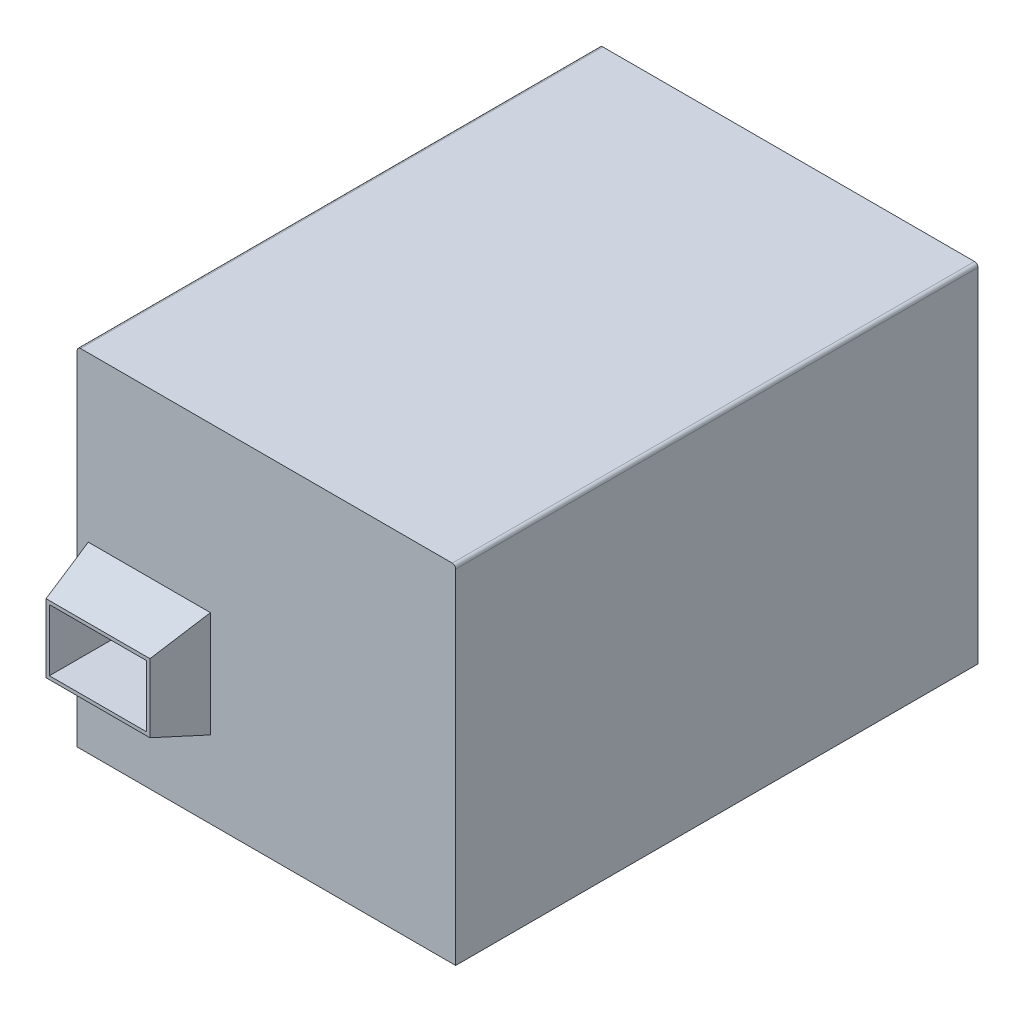
from build123d import *

# Parameters (mm, degrees)
SKETCH1_W           = 1105
SKETCH1_H           = 1012.5
SKETCH1_W_2         = 285
SKETCH1_H_2         = 200
SKETCH1_W_3         = 980
SKETCH1_H_3         = 100
BOSS_EXTRUDE1_DEPTH = 1400
SKETCH2_W           = 1105
SKETCH2_H           = 1012.5
BOSS_EXTRUDE3_DEPTH = 62.5
SKETCH3_W           = 980
SKETCH3_H           = 887.5
CUT_EXTRUDE1_DEPTH  = 700
BOSS_EXTRUDE4_REACH = 1107.19
SKETCH5_W           = 980
SKETCH5_H           = 100
SKETCH4_W           = 65
SKETCH4_H           = 10
SKETCH4_W_2         = 60
BOSS_EXTRUDE5_DEPTH = 10
FILLET1_R           = 10
BOSS_EXTRUDE6_START = 62.5
BOSS_EXTRUDE6_DEPTH = 62.5
BOSS_EXTRUDE7_START = -62.5
BOSS_EXTRUDE7_DEPTH = 300
CHAMFER3_SIZE2      = 150
CHAMFER3_SIZE       = 26.449047106
CHAMFER4_SIZE       = 30
CHAMFER4_SIZE_2     = 170.138454589
SKETCH14_W          = 283.550952894
SKETCH14_H          = 180
CUT_EXTRUDE4_DEPTH  = 259


# Some blends are built 0.0001 mm under size
with BuildPart() as part:
    # Sketch1 → Boss-Extrude1 (new body)
    with BuildSketch(Plane.XY):
        with Locations((22.5, 50)):
            Rectangle(SKETCH1_W, SKETCH1_H)
        with Locations((370, 131.25)):
            Rectangle(SKETCH1_W_2, SKETCH1_H_2, mode=Mode.SUBTRACT)
        with Locations((370, 393.75)):
            Rectangle(SKETCH1_W_2, SKETCH1_H_2, mode=Mode.SUBTRACT)
        with Locations((22.5, 393.75)):
            Rectangle(SKETCH1_W_2, SKETCH1_H_2, mode=Mode.SUBTRACT)
        with Locations((-325, 393.75)):
            Rectangle(SKETCH1_W_2, SKETCH1_H_2, mode=Mode.SUBTRACT)
        with Locations((-325, 131.25)):
            Rectangle(SKETCH1_W_2, SKETCH1_H_2, mode=Mode.SUBTRACT)
        with Locations((-325, -131.25)):
            Rectangle(SKETCH1_W_2, SKETCH1_H_2, mode=Mode.SUBTRACT)
        with Locations((22.5, -343.75)):
            Rectangle(SKETCH1_W_3, SKETCH1_H_3, mode=Mode.SUBTRACT)
        with Locations((370, -131.25)):
            Rectangle(SKETCH1_W_2, SKETCH1_H_2, mode=Mode.SUBTRACT)
        with Locations((22.5, -131.25)):
            Rectangle(SKETCH1_W_2, SKETCH1_H_2, mode=Mode.SUBTRACT)
        with Locations((22.5, 131.25)):
            Rectangle(SKETCH1_W_2, SKETCH1_H_2, mode=Mode.SUBTRACT)
    extrude(amount=-BOSS_EXTRUDE1_DEPTH)

    # Sketch2 → Boss-Extrude3 (add)
    with BuildSketch(Plane(origin=(0, 0, -1400), x_dir=(-1, 0, 0), z_dir=(0, 0, -1))):
        with Locations((-22.5, 50)):
            Rectangle(SKETCH2_W, SKETCH2_H)
    extrude(amount=BOSS_EXTRUDE3_DEPTH)

    # Sketch3 → Cut-Extrude1 (cut)
    with BuildSketch(Plane.XY):
        with Locations((22.5, 50)):
            Rectangle(SKETCH3_W, SKETCH3_H)
    extrude(amount=-CUT_EXTRUDE1_DEPTH, mode=Mode.SUBTRACT)

    # Sketch5 → Boss-Extrude4 (add, up to next)
    with BuildSketch(Plane.XY.offset(-700), mode=Mode.PRIVATE) as boss_extrude4_sk1:
        with Locations((22.5, -343.75)):
            Rectangle(SKETCH5_W, SKETCH5_H)
    boss_extrude4_tool1 = extrude(boss_extrude4_sk1.sketch, amount=-BOSS_EXTRUDE4_REACH, mode=Mode.PRIVATE) - part.part
    add(boss_extrude4_tool1.solids().sort_by_distance((22.5, -343.75, -700))[0])

    # Sketch4 → Boss-Extrude5 (add)
    with BuildSketch(Plane.XY.offset(-700)):
        with Locations((-325, 298.75)):
            Rectangle(SKETCH4_W, SKETCH4_H)
        with Locations((-437.5, 298.75)):
            Rectangle(SKETCH4_W_2, SKETCH4_H)
        with Locations((-212.5, 298.75)):
            Rectangle(SKETCH4_W_2, SKETCH4_H)
        with Locations((-90, 298.75)):
            Rectangle(SKETCH4_W_2, SKETCH4_H)
        with Locations((22.5, 298.75)):
            Rectangle(SKETCH4_W, SKETCH4_H)
        with Locations((135, 298.75)):
            Rectangle(SKETCH4_W_2, SKETCH4_H)
        with Locations((257.5, 298.75)):
            Rectangle(SKETCH4_W_2, SKETCH4_H)
        with Locations((370, 298.75)):
            Rectangle(SKETCH4_W, SKETCH4_H)
        with Locations((482.5, 298.75)):
            Rectangle(SKETCH4_W_2, SKETCH4_H)
        with Locations((-437.5, 36.25)):
            Rectangle(SKETCH4_W_2, SKETCH4_H)
        with Locations((-325, 36.25)):
            Rectangle(SKETCH4_W, SKETCH4_H)
        with Locations((-212.5, 36.25)):
            Rectangle(SKETCH4_W_2, SKETCH4_H)
        with Locations((-90, 36.25)):
            Rectangle(SKETCH4_W_2, SKETCH4_H)
        with Locations((22.5, 36.25)):
            Rectangle(SKETCH4_W, SKETCH4_H)
        with Locations((135, 36.25)):
            Rectangle(SKETCH4_W_2, SKETCH4_H)
        with Locations((257.5, 36.25)):
            Rectangle(SKETCH4_W_2, SKETCH4_H)
        with Locations((370, 36.25)):
            Rectangle(SKETCH4_W, SKETCH4_H)
        with Locations((482.5, 36.25)):
            Rectangle(SKETCH4_W_2, SKETCH4_H)
        with Locations((-437.5, -226.25)):
            Rectangle(SKETCH4_W_2, SKETCH4_H)
        with Locations((-325, -226.25)):
            Rectangle(SKETCH4_W, SKETCH4_H)
        with Locations((-212.5, -226.25)):
            Rectangle(SKETCH4_W_2, SKETCH4_H)
        with Locations((-90, -226.25)):
            Rectangle(SKETCH4_W_2, SKETCH4_H)
        with Locations((22.5, -226.25)):
            Rectangle(SKETCH4_W, SKETCH4_H)
        with Locations((135, -226.25)):
            Rectangle(SKETCH4_W_2, SKETCH4_H)
        with Locations((257.5, -226.25)):
            Rectangle(SKETCH4_W_2, SKETCH4_H)
        with Locations((370, -226.25)):
            Rectangle(SKETCH4_W, SKETCH4_H)
        with Locations((482.5, -226.25)):
            Rectangle(SKETCH4_W_2, SKETCH4_H)
    extrude(amount=-BOSS_EXTRUDE5_DEPTH)

    # Fillet1
    fillet1_edges = [part.edges().sort_by_distance(p)[0] for p in [
        (-530, 556.25, -731.25),
        (575, 556.25, -731.25),
    ]]
    fillet(fillet1_edges, radius=FILLET1_R)

    # Sketch6 → Boss-Extrude6 (add)
    with BuildSketch(Plane.XY.offset(BOSS_EXTRUDE6_START)):
        with BuildLine():
            Line((-530, -456.25), (575, -456.25))
            Line((575, -456.25), (575, 546.25))
            ThreePointArc((575, 546.25), (572.071067812, 553.321067812), (565, 556.25))
            Line((565, 556.25), (-520, 556.25))
            ThreePointArc((-520, 556.25), (-527.071067812, 553.321067812), (-530, 546.25))
            Line((-530, 546.25), (-530, -456.25))
        make_face()
    extrude(amount=-BOSS_EXTRUDE6_DEPTH)

    # Sketch8 → Boss-Extrude7 (add)
    with BuildSketch(Plane.ZY.offset(530).offset(BOSS_EXTRUDE7_START)):
        Polygon((62.5, 77.94107028), (212.5, 23.34553514), (212.5, -176.65446486), (62.5, -231.25), align=None)
    extrude(amount=-BOSS_EXTRUDE7_DEPTH)

    # Chamfer3
    chamfer3_edges = [part.edges().sort_by_distance(p)[0] for p in [
        (-167.5, -76.65446486, 62.5),
    ]]
    chamfer3_side = [part.faces().sort_by_distance(p)[0] for p in [
        (-166.971019058, -76.65446486, 62.5),
    ]]
    chamfer(chamfer3_edges, length=CHAMFER3_SIZE - 0.0001, length2=CHAMFER3_SIZE2 - 0.0001, reference=chamfer3_side[0])  # a hair under: the kernel refuses the full size

    # Chamfer4
    # the kernel refuses this chamfer: 170.138454589, 30 mm, written as the material it adds along each edge
    with BuildSketch(Plane(origin=(-467.5, -673.361375011, 62.5), x_dir=(-0.9776715712462578, 0, -0.21013876076743535), z_dir=(0, 1, 0))) as chamfer4_piece_1_section:
        Polygon((CHAMFER4_SIZE * 0.977671571246, CHAMFER4_SIZE * 0.210138760767), (-CHAMFER4_SIZE_2 * 0.210138760767, CHAMFER4_SIZE_2 * 0.977671571244), (0, 0), align=None)
    chamfer4_piece_1 = extrude(amount=1193.413820303, mode=Mode.PRIVATE)
    chamfer4_piece_1 = split(chamfer4_piece_1, bisect_by=Plane(origin=(-476.496724396, -196.562071995, 157.804298923), z_dir=(0, 0.9396926207859072, -0.34202014332567215)), keep=Keep.TOP, mode=Mode.PRIVATE)
    chamfer4_piece_1 = split(chamfer4_piece_1, bisect_by=Plane(origin=(-476.496724396, 43.253142274, 157.804298923), z_dir=(0, -0.9396926207859073, -0.3420201433256722)), keep=Keep.TOP, mode=Mode.PRIVATE)
    chamfer4_piece_1 = split(chamfer4_piece_1, bisect_by=Plane(origin=(-476.496724396, -76.65446486, 212.5), z_dir=(0, 0, -1)), keep=Keep.TOP, mode=Mode.PRIVATE)
    add(chamfer4_piece_1)

    # Sketch14 → Cut-Extrude4 (cut)
    with BuildSketch(Plane.XY.offset(212.5)):
        with Locations((-319.275476447, -76.65446486)):
            Rectangle(SKETCH14_W, SKETCH14_H)
    extrude(amount=-CUT_EXTRUDE4_DEPTH, mode=Mode.SUBTRACT)


solid = part.part
